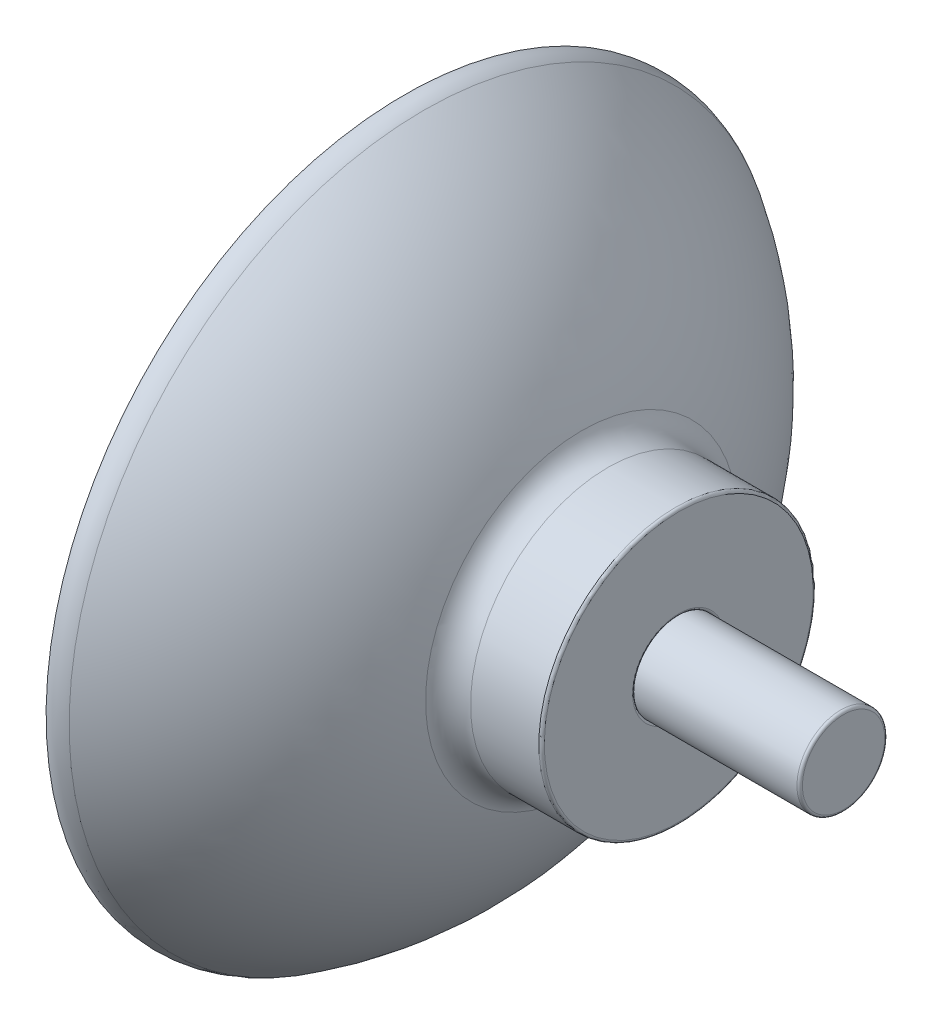
from build123d import *

# Parameters (mm, degrees)
FILLET1_R = 0.15
FILLET2_R = 1.5
FILLET3_R = 0.15


with BuildPart() as part:
    # Sketch1 → Revolve2 (revolve)
    with BuildSketch(Plane.XY):
        with BuildLine():
            Line((0, 4), (0, 0))
            Line((0, 0), (2, 0))
            Line((2, 0), (2, 4.75))
            Line((2, 4.75), (4, 4.75))
            Line((4, 4.75), (4, 2.375))
            Line((4, 2.375), (5, 2.375))
            Line((5, 2.375), (5, 7.5))
            Line((5, 7.5), (0, 7.5))
            ThreePointArc((0, 7.5), (-3.694854211, 14.794116631), (-10, 20))
            Line((-10, 20), (-10, 19.5))
            ThreePointArc((-10, 19.5), (-3.297071482, 12.84866356), (0, 4))
        make_face()
    revolve(axis=Axis((0, 0, 0), (-1, 0, 0)))

    # Fillet1
    fillet1_edges = [part.edges().sort_by_distance(p)[0] for p in [
        (5, -7.5, 0),
        (5, -2.375, 0),
        (4, -2.375, 0),
        (0, -4, 0),
        (-10, -19.5, 0),
    ]]
    fillet(fillet1_edges, radius=FILLET1_R)

    # Fillet2
    # the kernel refuses this fillet: 1.5 mm, written as the material it adds along each edge
    with BuildSketch(Plane(origin=(0, 0, 0), x_dir=(0, 1, 0), z_dir=(0, 0, 1))) as fillet2_piece_1:
        with BuildLine():
            CenterArc((9, -1.117230926), FILLET2_R, 108.15675825, 71.84324175)
            Line((7.5, -1.117230926), (7.5, 0))
            ThreePointArc((7.5, 0), (8.018361801, 0.147084824), (8.532573187, 0.308080329))
        make_face()
    revolve(axis=Axis((0, 0, 0), (-1, 0, 0)))
    # the kernel refuses this fillet: 1.5 mm, written as the material it takes off along each edge
    with BuildSketch(Plane(origin=(-10, 0, 0), x_dir=(0, 1, 0), z_dir=(0, 0, 1))) as fillet2_2_piece_1:
        with BuildLine():
            CenterArc((18.111217478, -0.293092194), FILLET2_R, 328.720951381, 42.546835999)
            ThreePointArc((19.393190597, -1.071902134), (19.704849183, -0.540623634), (20, 0))
            Line((20, 0), (19.58230448, 0))
        make_face()
    revolve(axis=Axis((-10, 0, 0), (-1, 0, 0)), mode=Mode.SUBTRACT)

    # Sketch2 → Revolve3 (revolve)
    with BuildSketch(Plane(origin=(0, 0, 0), x_dir=(1, 0, 0), z_dir=(0, 1, 0))):
        Polygon((2, 0), (2, 4.76), (4.007174432, 4.76), (4.007174432, 2.4), (14.007174432, 2.4), (14.007174432, 0), align=None)
    revolve(axis=Axis((14.007174432, 0, 0), (-1, 0, 0)))

    # Fillet3
    fillet3_edges = [part.edges().sort_by_distance(p)[0] for p in [
        (14.007174432, 0, 2.4),
    ]]
    fillet(fillet3_edges, radius=FILLET3_R)


solid = part.part
